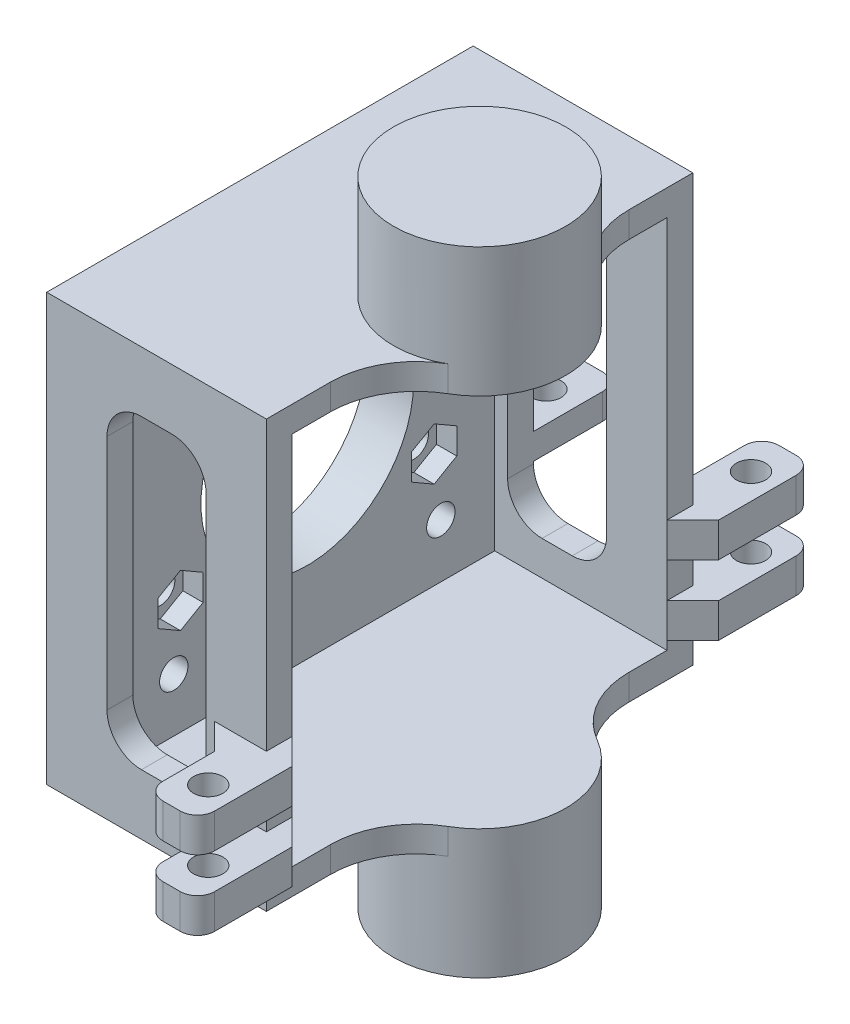
from build123d import *

# Parameters (mm, degrees)
CROQUIS1_W              = 47
CROQUIS1_H              = 47
CROQUIS1_R              = 1.65
SALIENTE_EXTRUIR1_DEPTH = 5.5
CORTAR_EXTRUIR1_DEPTH   = 2.35
CROQUIS7_R              = 12.35
CORTAR_EXTRUIR2_DEPTH   = 5.5
CROQUIS8_R              = 1.7
CORTAR_EXTRUIR3_DEPTH   = 5.5
CROQUIS9_W              = 49.5
CROQUIS9_H              = 49.5
CROQUIS9_W_2            = 43.5
CROQUIS9_H_2            = 43.5
SALIENTE_EXTRUIR2_DEPTH = 25.5
CROQUIS10_R             = 10
SALIENTE_EXTRUIR3_DEPTH = 15
CORTAR_EXTRUIR4_REACH   = 73.141
REDONDEO1_R             = 10
CROQUIS13_R             = 1.7
SALIENTE_EXTRUIR5_DEPTH = 12.1
CORTAR_EXTRUIR5_REACH   = 73.141
CROQUIS14_W             = 6
CROQUIS14_H             = 4.1
CHAFL_N1_SIZE           = 3
CROQUIS15_W             = 7
CROQUIS15_H             = 3
SALIENTE_EXTRUIR6_DEPTH = 10
CORTAR_EXTRUIR6_REACH   = 73.157
CROQUIS16_R             = 1.7
REDONDEO2_R             = 2
REDONDEO4_R             = 2
CROQUIS18_R             = 3.25
CORTAR_EXTRUIR7_DEPTH   = 2.5


# Some blends are built 0.0001 mm under size
with BuildPart() as part:
    # Croquis1 → Saliente-Extruir1 (new body)
    with BuildSketch(Plane(origin=(0, 0, 0), x_dir=(0, 0, -1), z_dir=(1, 0, 0))):
        Rectangle(CROQUIS1_W, CROQUIS1_H)
        with Locations((-15.5, 15.5)):
            Circle(CROQUIS1_R, mode=Mode.SUBTRACT)
        with Locations((15.5, 15.5)):
            Circle(CROQUIS1_R, mode=Mode.SUBTRACT)
        with Locations((15.5, -15.5)):
            Circle(CROQUIS1_R, mode=Mode.SUBTRACT)
        with Locations((-15.5, -15.5)):
            Circle(CROQUIS1_R, mode=Mode.SUBTRACT)
    extrude(amount=SALIENTE_EXTRUIR1_DEPTH)

    # Croquis2 → Cortar-Extruir1 (cut)
    with BuildSketch(Plane(origin=(5.5, 0, 0), x_dir=(0, 0, -1), z_dir=(1, 0, 0))):
        Polygon((0, 13.968911087), (2.625, 15.484455543), (2.625, 18.515544457), (0, 20.031088913), (-2.625, 18.515544457), (-2.625, 15.484455543), align=None)
        Polygon((14.722431864, -11.531088913), (17.347431864, -10.015544457), (17.347431864, -6.984455543), (14.722431864, -5.468911087), (12.097431864, -6.984455543), (12.097431864, -10.015544457), align=None)
        Polygon((-17.347431864, -6.984455543), (-17.347431864, -10.015544457), (-14.722431864, -11.531088913), (-12.097431864, -10.015544457), (-12.097431864, -6.984455543), (-14.722431864, -5.468911087), align=None)
    extrude(amount=-CORTAR_EXTRUIR1_DEPTH, mode=Mode.SUBTRACT)

    # Croquis7 → Cortar-Extruir2 (cut)
    with BuildSketch(Plane(origin=(5.5, 0, 0), x_dir=(0, 0, -1), z_dir=(1, 0, 0))):
        Circle(CROQUIS7_R)
    extrude(amount=-CORTAR_EXTRUIR2_DEPTH, mode=Mode.SUBTRACT)

    # Croquis8 → Cortar-Extruir3 (cut)
    with BuildSketch(Plane(origin=(5.5, 0, 0), x_dir=(0, 0, -1), z_dir=(1, 0, 0))):
        with Locations((0, 17)):
            Circle(CROQUIS8_R)
        with Locations((14.722431864, -8.5)):
            Circle(CROQUIS8_R)
        with Locations((-14.722431864, -8.5)):
            Circle(CROQUIS8_R)
    extrude(amount=-CORTAR_EXTRUIR3_DEPTH, mode=Mode.SUBTRACT)

    # Croquis9 → Saliente-Extruir2 (add)
    with BuildSketch(Plane(origin=(0, 0, 0), x_dir=(0, 0, -1), z_dir=(1, 0, 0))):
        Rectangle(CROQUIS9_W, CROQUIS9_H)
        Rectangle(CROQUIS9_W_2, CROQUIS9_H_2, mode=Mode.SUBTRACT)
    extrude(amount=SALIENTE_EXTRUIR2_DEPTH)

    # Croquis10 → Saliente-Extruir3 (add)
    with BuildSketch(Plane(origin=(0, 21.75, 0), x_dir=(1, 0, 0), z_dir=(0, 1, 0))):
        with Locations(Location((25.5, 0, 0), (0, 0, 270))):
            Circle(CROQUIS10_R)
    saliente_extruir3 = extrude(amount=SALIENTE_EXTRUIR3_DEPTH)

    # Simetría1: Saliente-Extruir3 across plane
    add(saliente_extruir3.mirror(Plane.ZX))

    # Cortar-Extruir4: up to this face of the body (flat: up to its plane)
    cortar_extruir4_end = Plane(part.part.faces().sort_by_distance((12.75, 0, 24.75))[0])
    # Croquis11 → Cortar-Extruir4 (cut, up to the picked face)
    with BuildSketch(Plane(origin=(0, 0, -24.75), x_dir=(-1, 0, 0), z_dir=(0, 0, -1)), mode=Mode.PRIVATE) as cortar_extruir4_sk1:
        with BuildLine():
            Line((-7, -13.75), (-7, 13.75))
            ThreePointArc((-7, 13.75), (-8.171572875, 16.578427125), (-11, 17.75))
            Line((-11, 17.75), (-14.5, 17.75))
            ThreePointArc((-14.5, 17.75), (-17.328427125, 16.578427125), (-18.5, 13.75))
            Line((-18.5, 13.75), (-18.5, -13.75))
            ThreePointArc((-18.5, -13.75), (-17.328427125, -16.578427125), (-14.5, -17.75))
            Line((-14.5, -17.75), (-11, -17.75))
            ThreePointArc((-11, -17.75), (-8.171572875, -16.578427125), (-7, -13.75))
        make_face()
    cortar_extruir4_tool1 = split(extrude(cortar_extruir4_sk1.sketch, amount=-CORTAR_EXTRUIR4_REACH, mode=Mode.PRIVATE), bisect_by=cortar_extruir4_end, keep=Keep.BOTH, mode=Mode.PRIVATE)
    add(cortar_extruir4_tool1.solids().sort_by(Axis((12.75, 0, -24.75), (0, 0, 1)))[0], mode=Mode.SUBTRACT)

    # Redondeo1
    # the kernel refuses this fillet: 10 mm, written as the material it adds along each edge
    with BuildSketch(Plane(origin=(25.5, 21.75, 10), x_dir=(0, 0, 1), z_dir=(0, 1, 0)), Plane(origin=(25.5, 24.75, -10), x_dir=(0, 0, -1), z_dir=(0, -1, 0))) as redondeo1_piece_1:
        with BuildLine():
            CenterArc((7.320508076, 10), REDONDEO1_R, 210, 60)
            ThreePointArc((-1.339745962, 5), (-0.340741737, 2.588190451), (0, 0))
            Line((0, 0), (7.320508076, 0))
        make_face()
    extrude(amount=3)
    with BuildSketch(Plane(origin=(25.5, -24.75, -10), x_dir=(0, 0, -1), z_dir=(0, 1, 0))) as redondeo1_piece_2:
        with BuildLine():
            CenterArc((7.320508076, -10), REDONDEO1_R, 90, 60)
            ThreePointArc((-1.339745962, -5), (-0.340741737, -2.588190451), (0, 0))
            Line((0, 0), (7.320508076, 0))
        make_face()
    extrude(amount=3)
    with BuildSketch(Plane(origin=(25.5, -21.75, 10), x_dir=(0.9659258262890682, 0, -0.2588190451025209), z_dir=(0, -1, 0))) as redondeo1_piece_3:
        with BuildLine():
            CenterArc((7.764571353, 9.659258263), REDONDEO1_R, 195, 60)
            Line((-1.89468691, 7.071067812), (0, 0))
            ThreePointArc((0, 0), (2.588190451, 0.340741737), (5.176380902, 0))
        make_face()
    extrude(amount=3)

    # Croquis13 → Saliente-Extruir5 (add)
    with BuildSketch(Plane.XZ.offset(20.75)):
        Polygon((28.5, -35.75), (28.5, -24.75), (22.5, -24.75), (22.5, -35.75), (23.977414586, -35.75), (27.022585414, -35.75), align=None)
        with Locations(Location((25.5, -31.5, 0), (0, 0, 270))):
            Circle(CROQUIS13_R, mode=Mode.SUBTRACT)
    saliente_extruir5 = extrude(amount=-SALIENTE_EXTRUIR5_DEPTH)

    # Cortar-Extruir5: up to this face of the body (flat: up to its plane)
    cortar_extruir5_end = Plane(part.part.faces().sort_by_distance((25.5, -14.7, -35.75))[0])
    # Croquis14 → Cortar-Extruir5 (cut, up to the picked face)
    with BuildSketch(Plane(origin=(0, 0, -24.75), x_dir=(-1, 0, 0), z_dir=(0, 0, -1)), mode=Mode.PRIVATE) as cortar_extruir5_sk1:
        with Locations((-25.5, -14.7)):
            Rectangle(CROQUIS14_W, CROQUIS14_H)
    cortar_extruir5_tool1 = split(extrude(cortar_extruir5_sk1.sketch, amount=CORTAR_EXTRUIR5_REACH, mode=Mode.PRIVATE), bisect_by=cortar_extruir5_end, keep=Keep.BOTH, mode=Mode.PRIVATE)
    cortar_extruir5 = cortar_extruir5_tool1.solids().sort_by(Axis((25.5, -14.7, -24.75), (0, 0, -1)))[0]
    add(cortar_extruir5, mode=Mode.SUBTRACT)

    # Simetría2: Saliente-Extruir5, Cortar-Extruir5 across plane
    add(saliente_extruir5.mirror(Plane.XY))
    add(cortar_extruir5.mirror(Plane.XY), mode=Mode.SUBTRACT)

    # Chaflán1
    chafl_n1_edges = [part.edges().sort_by_distance(p)[0] for p in [
        (25.5, -18.75, -24.75),
        (22.5, -10.65, -24.75),
        (22.5, -18.75, -24.75),
        (25.5, -10.65, -24.75),
        (25.5, -10.65, 24.75),
        (22.5, -10.65, 24.75),
        (22.5, -18.75, 24.75),
        (25.5, -18.75, 24.75),
    ]]
    chamfer(chafl_n1_edges, length=CHAFL_N1_SIZE - 0.0001)  # a hair under: the kernel refuses the full size

    # Croquis15 → Saliente-Extruir6 (add)
    with BuildSketch(Plane(origin=(0, 0, -24.75), x_dir=(-1, 0, 0), z_dir=(0, 0, -1))):
        with Locations((-3.5, 12)):
            Rectangle(CROQUIS15_W, CROQUIS15_H)
        with Locations((-3.5, -12)):
            Rectangle(CROQUIS15_W, CROQUIS15_H)
    extrude(amount=SALIENTE_EXTRUIR6_DEPTH)

    # Cortar-Extruir6: up to this face of the body (flat: up to its plane)
    cortar_extruir6_end = Plane(part.part.faces().sort_by_distance((3.5, 13.5, -29.75))[0])
    # Croquis16 → Cortar-Extruir6 (cut, up to the picked face)
    with BuildSketch(Plane.XZ.offset(13.5), mode=Mode.PRIVATE) as cortar_extruir6_sk1:
        with Locations((3.5, -29.75)):
            Circle(CROQUIS16_R)
    cortar_extruir6_tool1 = split(extrude(cortar_extruir6_sk1.sketch, amount=-CORTAR_EXTRUIR6_REACH, mode=Mode.PRIVATE), bisect_by=cortar_extruir6_end, keep=Keep.BOTH, mode=Mode.PRIVATE)
    add(cortar_extruir6_tool1.solids().sort_by(Axis((3.5, -13.5, -29.75), (0, 1, 0)))[0], mode=Mode.SUBTRACT)

    # Redondeo2
    redondeo2_edges = [part.edges().sort_by_distance(p)[0] for p in [
        (0, 12, -34.75),
        (7, 12, -34.75),
        (0, -12, -34.75),
        (7, -12, -34.75),
    ]]
    fillet(redondeo2_edges, radius=REDONDEO2_R)

    # Redondeo4
    redondeo4_edges = [part.edges().sort_by_distance(p)[0] for p in [
        (28.5, -10.65, -35.75),
        (22.5, -10.65, -35.75),
        (28.5, -18.75, -35.75),
        (22.5, -18.75, -35.75),
        (22.5, -10.65, 35.75),
        (28.5, -10.65, 35.75),
        (22.5, -18.75, 35.75),
        (28.5, -18.75, 35.75),
    ]]
    fillet(redondeo4_edges, radius=REDONDEO4_R)

    # Croquis18 → Cortar-Extruir7 (cut)
    with BuildSketch(Plane.ZY):
        with Locations((-15.5, 15.5)):
            Circle(CROQUIS18_R)
        with Locations((15.5, 15.5)):
            Circle(CROQUIS18_R)
        with Locations((15.5, -15.5)):
            Circle(CROQUIS18_R)
        with Locations((-15.5, -15.5)):
            Circle(CROQUIS18_R)
    extrude(amount=-CORTAR_EXTRUIR7_DEPTH, mode=Mode.SUBTRACT)


solid = part.part
